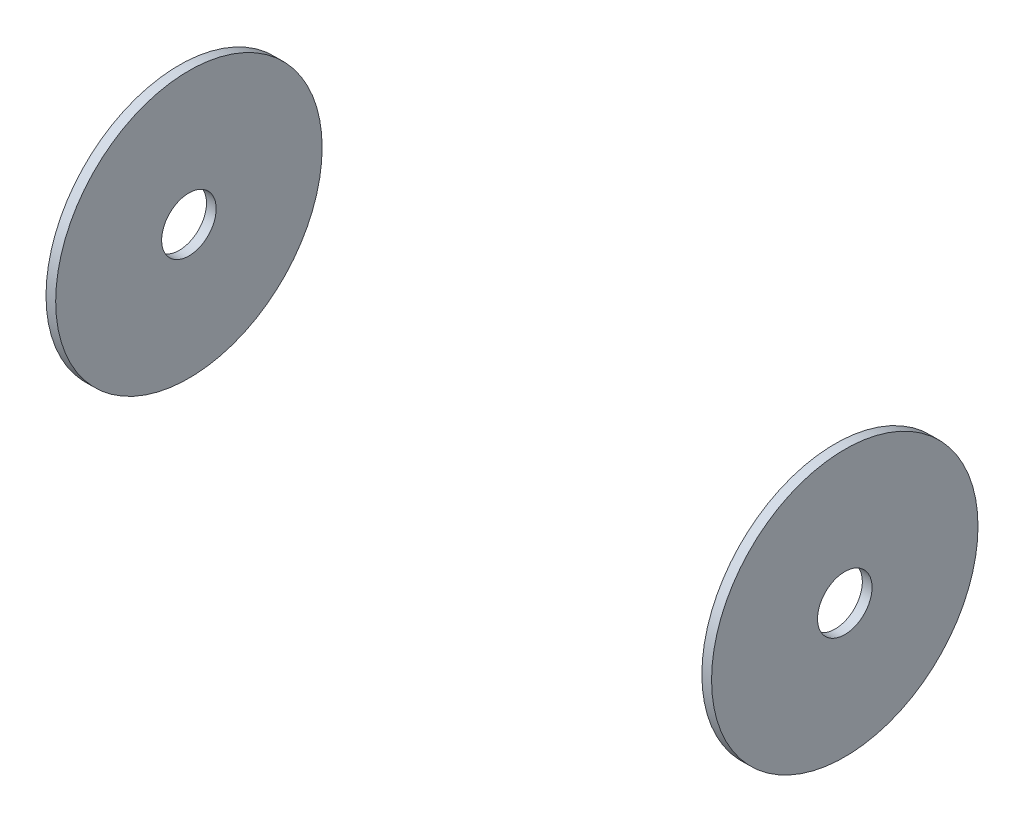
from build123d import *

# Parameters (mm, degrees)
SKETCH1_R           = 20.6375
SKETCH1_R_2         = 4.22275
BOSS_EXTRUDE1_DEPTH = 1.500000048


with BuildPart() as part:
    # Sketch1 → Boss-Extrude1 (new body)
    with BuildSketch(Plane(origin=(50.049999952, 0, 0), x_dir=(0, 0, -1), z_dir=(1, 0, 0))):
        with Locations((-177.8, 26.9875)):
            Circle(SKETCH1_R)
        with Locations((-177.8, 26.9875)):
            Circle(SKETCH1_R_2, mode=Mode.SUBTRACT)
    extrude(amount=BOSS_EXTRUDE1_DEPTH)


with BuildPart() as body_2:
    # Mirror2: mirrored copy
    add(part.part.mirror(Plane(origin=(0, 0, 0), x_dir=(0, 0, 1), z_dir=(1, 0, 0))))


solid = Compound([part.part, body_2.part])
